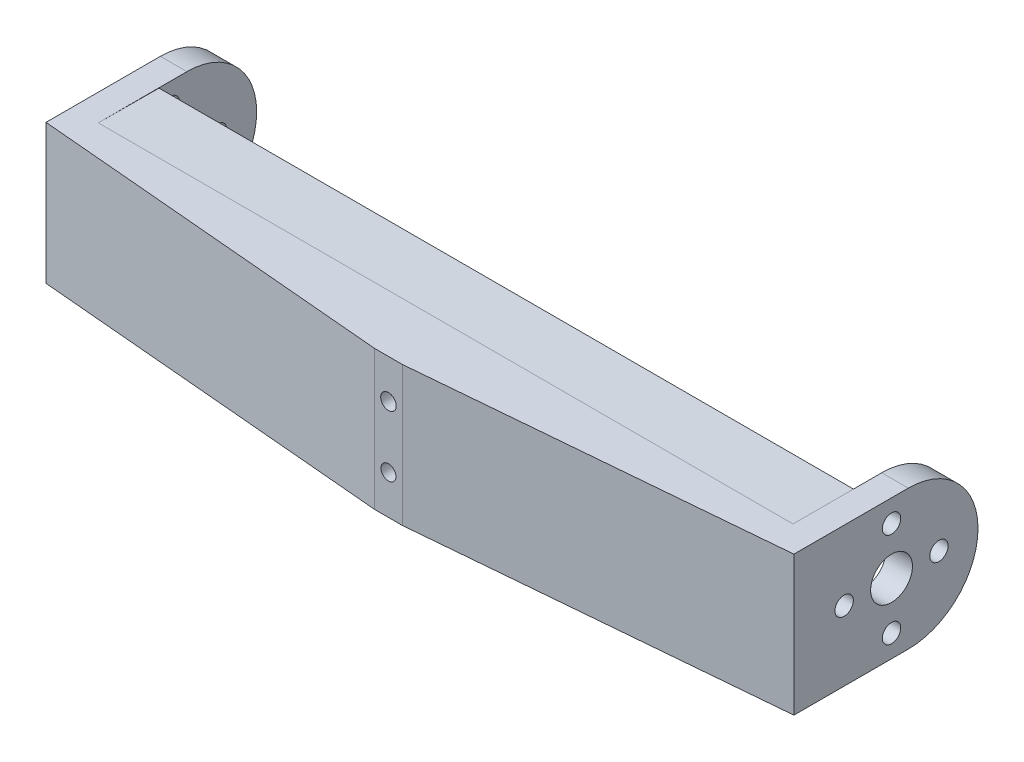
from build123d import *

# Parameters (mm, degrees)
RESSALTO_EXTRUS_O1_DEPTH = 25
ESBO_O2_R                = 3.75
ESBO_O2_R_2              = 1.65
CORTE_EXTRUS_O1_DEPTH    = 140.936789771
FILETE1_R                = 12.5
RESSALTO_EXTRUS_O2_REACH = 137.379
RESSALTO_EXTRUS_O3_DEPTH = 25
ESBO_O3_R                = 1.340765279
ESBO_O3_R_2              = 1.395401155
CORTE_EXTRUS_O4_DEPTH    = 25
ESBO_O10_R               = 1.55
CORTE_EXTRUS_O5_DEPTH    = 3


with BuildPart() as part:
    # Esboço1 → Ressalto-extrusão1 (new body)
    with BuildSketch(Plane(origin=(0, 0, 0), x_dir=(1, 0, 0), z_dir=(0, 1, 0))):
        Polygon((-59.715709909, 31.339816021), (-59.715709909, -1.660183979), (4.819954225, -7.306322984), (9.819954225, -7.306322984), (74.355618358, -1.660183979), (74.355618358, 31.339816021), (69.59163611, 31.339816021), (69.59163611, 2.942120769), (9.819954225, -2.287223796), (4.819954225, -2.287223796), (-54.951727661, 2.942120769), (-54.951727661, 31.339816021), align=None)
    extrude(amount=RESSALTO_EXTRUS_O1_DEPTH)

    # Esboço2 → Corte-extrusão1 (cut, through all)
    with BuildSketch(Plane(origin=(74.355618358, 0, 0), x_dir=(0, 0, -1), z_dir=(1, 0, 0))):
        with Locations((15.839816021, 12.5)):
            Circle(ESBO_O2_R)
        with Locations((24.339816021, 12.5)):
            Circle(ESBO_O2_R_2)
        with Locations((15.839816021, 4)):
            Circle(ESBO_O2_R_2)
        with Locations((15.839816021, 21)):
            Circle(ESBO_O2_R_2)
        with Locations((7.339816021, 12.5)):
            Circle(ESBO_O2_R_2)
    extrude(amount=-CORTE_EXTRUS_O1_DEPTH, mode=Mode.SUBTRACT)

    # Filete1
    filete1_edges = [part.edges().sort_by_distance(p)[0] for p in [
        (-57.333718785, 25, -31.339816021),
        (-57.333718785, 0, -31.339816021),
        (71.973627234, 25, -31.339816021),
        (71.973627234, 0, -31.339816021),
    ]]
    fillet(filete1_edges, radius=FILETE1_R - 0.0001)  # a hair under: the kernel refuses the full size

    # Ressalto-extrusão2: up to this face of the body (flat: up to its plane)
    ressalto_extrus_o2_end = Plane(part.part.faces().sort_by_distance((-54.951727661, 0.378342318, -10.891018395))[0])
    # Esboço6 → Ressalto-extrusão2 (add, up to the picked face)
    with BuildSketch(Plane.ZY.offset(-69.59163611), mode=Mode.PRIVATE) as ressalto_extrus_o2_sk1:
        with BuildLine():
            ThreePointArc((-13.839816021, 0.059742768), (-3.239816021, 12.5), (-13.839816021, 24.940257232))
            Line((-13.839816021, 24.940257232), (-2.942120769, 25))
            Line((-2.942120769, 25), (-2.942120769, 0))
            Line((-2.942120769, 0), (-13.839816021, 0.059742768))
        make_face()
    ressalto_extrus_o2_tool1 = split(extrude(ressalto_extrus_o2_sk1.sketch, amount=RESSALTO_EXTRUS_O2_REACH, mode=Mode.PRIVATE), bisect_by=ressalto_extrus_o2_end, keep=Keep.BOTH, mode=Mode.PRIVATE)
    add(ressalto_extrus_o2_tool1.solids().sort_by(Axis((69.591636, 24.697413, -8.389473), (-1, 0, 0)))[0])

    # Esboço8 → Ressalto-extrusão3 (add)
    with BuildSketch(Plane(origin=(0, 0, 0), x_dir=(-1, 0, 0), z_dir=(0, -1, 0))):
        Polygon((54.951727661, 2.942120769), (-4.819954225, -2.287223796), (-9.819954225, -2.287223796), (-69.59163611, 2.942120769), align=None)
    extrude(amount=-RESSALTO_EXTRUS_O3_DEPTH)

    # Esboço3 → Corte-extrusão4 (cut)
    with BuildSketch(Plane.XY.offset(7.306322984)):
        with Locations((7.319954225, 7)):
            Circle(ESBO_O3_R)
        with Locations((7.319954225, 18)):
            Circle(ESBO_O3_R_2)
    extrude(amount=-CORTE_EXTRUS_O4_DEPTH, mode=Mode.SUBTRACT)

    # Esboço10 → Corte-extrusão5 (cut)
    with BuildSketch(Plane.XY.offset(-5.943677016)):
        with Locations(Location((7.319954225, 7, 0), (0, 0, 180))):
            Circle(ESBO_O10_R)
        with Locations(Location((7.319954225, 18, 0), (0, 0, 180))):
            Circle(ESBO_O10_R)
    extrude(amount=CORTE_EXTRUS_O5_DEPTH, mode=Mode.SUBTRACT)


solid = part.part
